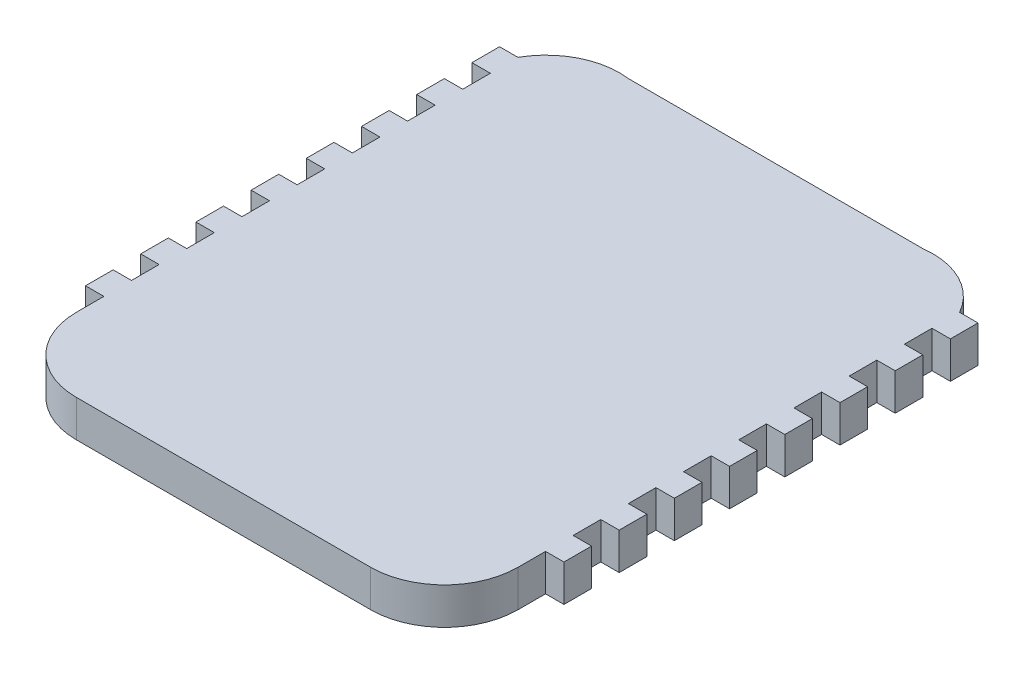
from build123d import *

# Parameters (mm, degrees)
BOSS_EXTRUDE1_DEPTH = 20
SKETCH3_W           = 15
SKETCH3_H           = 20
BOSS_EXTRUDE2_DEPTH = 10
SKETCH4_W           = 15
SKETCH4_H           = 20
BOSS_EXTRUDE3_DEPTH = 10


with BuildPart() as part:
    # Sketch1 → Boss-Extrude1 (new body)
    with BuildSketch(Plane(origin=(0, 0, 0), x_dir=(1, 0, 0), z_dir=(0, 1, 0))):
        with BuildLine():
            Line((-10, 30), (-10, 270))
            ThreePointArc((-10, 270), (6.943853154, 286.112293692), (30, 290))
            Line((30, 290), (190, 290))
            ThreePointArc((190, 290), (213.056146846, 286.112293692), (230, 270))
            Line((230, 270), (230, 30))
            ThreePointArc((230, 30), (218.284271247, 1.715728753), (190, -10))
            Line((190, -10), (30, -10))
            ThreePointArc((30, -10), (1.715728753, 1.715728753), (-10, 30))
        make_face()
    extrude(amount=BOSS_EXTRUDE1_DEPTH)

    # Sketch3 → Boss-Extrude2 (add)
    with BuildSketch(Plane.ZY.offset(10)):
        with Locations((-262.5, 10)):
            Rectangle(SKETCH3_W, SKETCH3_H)
        with Locations((-232.5, 10)):
            Rectangle(SKETCH3_W, SKETCH3_H)
        with Locations((-202.5, 10)):
            Rectangle(SKETCH3_W, SKETCH3_H)
        with Locations((-172.5, 10)):
            Rectangle(SKETCH3_W, SKETCH3_H)
        with Locations((-142.5, 10)):
            Rectangle(SKETCH3_W, SKETCH3_H)
        with Locations((-112.5, 10)):
            Rectangle(SKETCH3_W, SKETCH3_H)
        with Locations((-82.5, 10)):
            Rectangle(SKETCH3_W, SKETCH3_H)
        with Locations((-52.5, 10)):
            Rectangle(SKETCH3_W, SKETCH3_H)
    extrude(amount=BOSS_EXTRUDE2_DEPTH)

    # Sketch4 → Boss-Extrude3 (add)
    with BuildSketch(Plane(origin=(230, 0, 0), x_dir=(0, 0, -1), z_dir=(1, 0, 0))):
        with Locations((262.5, 10)):
            Rectangle(SKETCH4_W, SKETCH4_H)
        with Locations((232.5, 10)):
            Rectangle(SKETCH4_W, SKETCH4_H)
        with Locations((202.5, 10)):
            Rectangle(SKETCH4_W, SKETCH4_H)
        with Locations((172.5, 10)):
            Rectangle(SKETCH4_W, SKETCH4_H)
        with Locations((142.5, 10)):
            Rectangle(SKETCH4_W, SKETCH4_H)
        with Locations((112.5, 10)):
            Rectangle(SKETCH4_W, SKETCH4_H)
        with Locations((82.5, 10)):
            Rectangle(SKETCH4_W, SKETCH4_H)
        with Locations((52.5, 10)):
            Rectangle(SKETCH4_W, SKETCH4_H)
    extrude(amount=BOSS_EXTRUDE3_DEPTH)


solid = part.part
